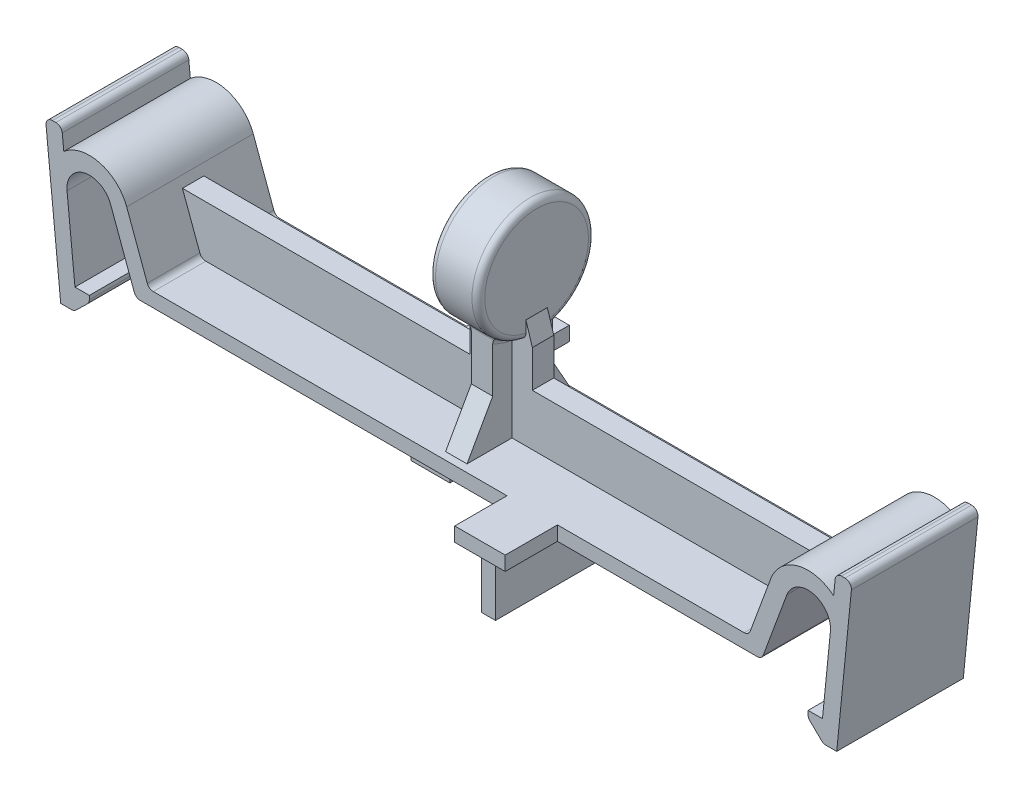
from build123d import *

# Parameters (mm, degrees)
BOSS_EXTRUDE1_DEPTH             = 7.385
BOSS_EXTRUDE2_REACH             = 51.333
BOSS_EXTRUDE2_DIRECTION_2_REACH = 51.333
BOSS_EXTRUDE3_DEPTH             = 1.25
BOSS_EXTRUDE4_DEPTH             = 2.5
SKETCH6_R                       = 6.8
BOSS_EXTRUDE5_DEPTH             = 2.875
FILLET1_R                       = 0.75
BOSS_EXTRUDE6_DEPTH             = 1.66
BOSS_EXTRUDE7_DEPTH             = 6.52
CUT_EXTRUDE1_DEPTH              = 56.58709885870133
CUT_EXTRUDE1_DEPTH_BACK         = 56.58709885870133
BOSS_EXTRUDE8_DEPTH             = 2.5


with BuildPart() as part:
    # Sketch2 → Boss-Extrude1 (new, symmetric)
    with BuildSketch(Plane.XY):
        with BuildLine():
            Line((-37.58052948652131, 8.667483902968542), (-35.18074791839629, 2.1508249005767097))
            ThreePointArc((-35.18074791839629, 2.1508249005767097), (-34.9059736753901, 1.794824689796692), (-34.47695230329278, 1.6599999999999993))
            Line((-34.47695230329278, 1.6599999999999993), (34.47695230329278, 1.6599999999999993))
            ThreePointArc((34.47695230329278, 1.6599999999999993), (34.9059736753901, 1.794824689796692), (35.18074791839629, 2.1508249005767097))
            Line((35.18074791839629, 2.1508249005767097), (37.58052948652131, 8.667483902968542))
            ThreePointArc((37.58052948652131, 8.667483902968542), (40.747280598577476, 11.545063491427863), (44.92008250779222, 10.598226060777561))
            Line((44.92008250779222, 10.598226060777561), (45.09820598941357, 12.38442253386073))
            ThreePointArc((45.09820598941357, 12.38442253386073), (45.341173921250764, 12.866020188660242), (45.84450437910348, 13.059999999999992))
            Line((45.84450437910348, 13.059999999999992), (46.246488363183424, 13.059999999999992))
            ThreePointArc((46.246488363183424, 13.059999999999992), (46.80250855184368, 12.813330457852704), (46.992786752873336, 12.235577466139242))
            Line((46.992786752873336, 12.235577466139242), (45.28, -4.940000000000007))
            Line((45.28, -4.940000000000007), (44.024420494730734, -4.940000000000006))
            ThreePointArc((44.024420494730734, -4.940000000000006), (43.7423500779441, -4.8849361697118825), (43.50169800131545, -4.727830079930183))
            Line((43.50169800131545, -4.727830079930183), (42.16727750658472, -3.4308933069615497))
            ThreePointArc((42.16727750658472, -3.4308933069615497), (41.999152017422986, -3.1850034006445043), (41.940000000000005, -2.89306322703137))
            Line((41.940000000000005, -2.89306322703137), (41.94, -2.4600000000000075))
            Line((41.94, -2.4600000000000075), (43.61788718673134, -2.460000000000006))
            Line((43.61788718673134, -2.460000000000006), (44.5419744029091, 6.806612752757441))
            ThreePointArc((44.5419744029091, 6.806612752757441), (42.51472618832063, 9.630449903014618), (39.457317793464, 7.976350304506424))
            Line((39.457317793464, 7.976350304506424), (36.700747918396296, 0.4908249005767054))
            ThreePointArc((36.700747918396296, 0.4908249005767054), (36.425973675390104, 0.1348246897966895), (35.99695230329279, -4.41e-15))
            Line((35.99695230329279, -4.41e-15), (-35.99695230329279, -4.41e-15))
            ThreePointArc((-35.99695230329279, -4.41e-15), (-36.425973675390104, 0.1348246897966895), (-36.700747918396296, 0.4908249005767054))
            Line((-36.700747918396296, 0.4908249005767054), (-39.457317793464, 7.976350304506424))
            ThreePointArc((-39.457317793464, 7.976350304506424), (-42.51472618832063, 9.63044990301462), (-44.5419744029091, 6.806612752757441))
            Line((-44.5419744029091, 6.806612752757441), (-43.61788718673134, -2.460000000000006))
            Line((-43.61788718673134, -2.460000000000006), (-41.94, -2.4600000000000075))
            Line((-41.94, -2.4600000000000075), (-41.940000000000005, -2.89306322703137))
            ThreePointArc((-41.940000000000005, -2.89306322703137), (-41.999152017422986, -3.1850034006445043), (-42.16727750658472, -3.4308933069615497))
            Line((-42.16727750658472, -3.4308933069615497), (-43.50169800131545, -4.727830079930183))
            ThreePointArc((-43.50169800131545, -4.727830079930183), (-43.7423500779441, -4.8849361697118825), (-44.024420494730734, -4.940000000000006))
            Line((-44.024420494730734, -4.940000000000006), (-45.28, -4.940000000000007))
            Line((-45.28, -4.940000000000007), (-46.992786752873336, 12.235577466139242))
            ThreePointArc((-46.992786752873336, 12.235577466139242), (-46.80250855184368, 12.813330457852704), (-46.246488363183424, 13.059999999999992))
            Line((-46.246488363183424, 13.059999999999992), (-45.84450437910348, 13.059999999999992))
            ThreePointArc((-45.84450437910348, 13.059999999999992), (-45.341173921250764, 12.866020188660242), (-45.09820598941357, 12.38442253386073))
            Line((-45.09820598941357, 12.38442253386073), (-44.92008250779222, 10.598226060777561))
            ThreePointArc((-44.92008250779222, 10.598226060777561), (-40.747280598577476, 11.545063491427863), (-37.58052948652131, 8.667483902968542))
        make_face()
    extrude(amount=BOSS_EXTRUDE1_DEPTH, both=True)

    # Sketch3 → Boss-Extrude2 (add, up to next)
    with BuildSketch(Plane(origin=(0, 0, 0), x_dir=(0, 0, -1), z_dir=(1, 0, 0)), mode=Mode.PRIVATE) as boss_extrude2_sk1:
        Polygon((-1.250000000000001, 1.6599999999999993), (1.250000000000001, 1.6599999999999993), (1.249999999999999, 7.659999999999999), (-1.250000000000001, 7.659999999999999), align=None)
    boss_extrude2_tool1 = extrude(boss_extrude2_sk1.sketch, amount=BOSS_EXTRUDE2_REACH, mode=Mode.PRIVATE) - part.part
    add(boss_extrude2_tool1.solids().sort_by_distance((0, 4.66, 0))[0])

    # Sketch3 → Boss-Extrude2 direction 2 (add, up to next)
    with BuildSketch(Plane(origin=(0, 0, 0), x_dir=(0, 0, -1), z_dir=(1, 0, 0)), mode=Mode.PRIVATE) as boss_extrude2_direction_2_sk1:
        Polygon((-1.250000000000001, 1.6599999999999993), (1.250000000000001, 1.6599999999999993), (1.249999999999999, 7.659999999999999), (-1.250000000000001, 7.659999999999999), align=None)
    boss_extrude2_direction_2_tool1 = extrude(boss_extrude2_direction_2_sk1.sketch, amount=-BOSS_EXTRUDE2_DIRECTION_2_REACH, mode=Mode.PRIVATE) - part.part
    add(boss_extrude2_direction_2_tool1.solids().sort_by_distance((0, 4.66, 0))[0])

    # Sketch4 → Boss-Extrude3 (add, symmetric)
    with BuildSketch(Plane(origin=(0, 0, 0), x_dir=(0, 0, -1), z_dir=(1, 0, 0))):
        Polygon((-6.5, 1.6599999999999993), (-3.4999999999999996, 6.999999999999997), (-3.5, 15.66), (3.5, 15.66), (3.4999999999999996, 6.999999999999997), (6.5, 1.6599999999999993), align=None)
    extrude(amount=BOSS_EXTRUDE3_DEPTH, both=True)

    # Sketch5 → Boss-Extrude4 (add)
    with BuildSketch(Plane.XY.offset(1.250000000000001)):
        Polygon((-3.625000000000003, 7.659999999999998), (3.625000000000005, 7.659999999999999), (3.6249999999999973, 11.979999999999999), (-3.625000000000003, 11.979999999999997), align=None)
    extrude(amount=-BOSS_EXTRUDE4_DEPTH)

    # Sketch6 → Boss-Extrude5 (add, symmetric)
    with BuildSketch(Plane(origin=(0, 0, 0), x_dir=(0, 0, -1), z_dir=(1, 0, 0))):
        with Locations((0, 18.970824900576712)):
            Circle(SKETCH6_R)
    extrude(amount=BOSS_EXTRUDE5_DEPTH, both=True)

    # Fillet1
    # the kernel refuses this fillet: 0.75 mm, written as the material it adds along each edge
    with BuildSketch(Plane(origin=(-1.25, 18.970824900576712, 0), x_dir=(0, -0.6848107633394334, 0.7287209468750454), z_dir=(0, 0.7287209468750454, 0.6848107633394334))) as fillet1_piece_1_section:
        with BuildLine():
            CenterArc((6.800000000000002 + FILLET1_R, -FILLET1_R), FILLET1_R, 90, 90)
            Line((6.800000000000002, -FILLET1_R), (6.800000000000002, 0))
            Line((6.800000000000002, 0), (6.800000000000002 + FILLET1_R, 0))
        make_face()
    fillet1_piece_1 = revolve(axis=Axis((-1.25, 18.970824900576712, 0), (1, 0, 0)), revolution_arc=93.55854684845208, mode=Mode.PRIVATE)
    fillet1_piece_1 = split(fillet1_piece_1, bisect_by=Plane(origin=(-1.462478270743082, 11.958346629833628, -3.5), z_dir=(0, 5e-17, 1)), keep=Keep.TOP, mode=Mode.PRIVATE)
    fillet1_piece_1 = split(fillet1_piece_1, bisect_by=Plane(origin=(-1.462478270743082, 11.958346629833628, 3.5), z_dir=(0, 5e-17, -1)), keep=Keep.TOP, mode=Mode.PRIVATE)
    add(fillet1_piece_1)
    with BuildSketch(Plane(origin=(-1.25, 13.140730561717348, -3.4999999999999996), x_dir=(0, -1, -1.08e-15), z_dir=(1, 0, 0))) as fillet1_piece_2:
        with BuildLine():
            CenterArc((0.41009796586971076, 0.75), FILLET1_R, 214.2575543531148, 55.74244564688513)
            ThreePointArc((-0.2097886869179458, 0.32781456953642274), (-0.10254856555185103, 0.16540849219664022), (0, 0))
            Line((0, 0), (0.4100979658697099, 0))
        make_face()
    extrude(amount=2.5)
    with BuildSketch(Plane(origin=(1.25, 18.970824900576712, 0), x_dir=(0, -0.6848107633394334, 0.7287209468750454), z_dir=(0, 0.7287209468750454, 0.6848107633394334))) as fillet1_piece_3_section:
        with BuildLine():
            CenterArc((6.800000000000002 + FILLET1_R, FILLET1_R), FILLET1_R, 180, 90)
            Line((6.800000000000002, FILLET1_R), (6.800000000000002, 0))
            Line((6.800000000000002, 0), (6.800000000000002 + FILLET1_R, 0))
        make_face()
    fillet1_piece_3 = revolve(axis=Axis((1.25, 18.970824900576712, 0), (1, 0, 0)), revolution_arc=93.55854684845208, mode=Mode.PRIVATE)
    fillet1_piece_3 = split(fillet1_piece_3, bisect_by=Plane(origin=(1.462478270743082, 11.958346629833628, -3.5), z_dir=(0, 5e-17, 1)), keep=Keep.TOP, mode=Mode.PRIVATE)
    fillet1_piece_3 = split(fillet1_piece_3, bisect_by=Plane(origin=(1.462478270743082, 11.958346629833628, 3.5), z_dir=(0, 5e-17, -1)), keep=Keep.TOP, mode=Mode.PRIVATE)
    add(fillet1_piece_3)
    with BuildSketch(Plane(origin=(-1.25, 13.140730561717348, 3.4999999999999996), x_dir=(0, 0.5390306606171568, 0.8422861431334554), z_dir=(1, 0, 0))) as fillet1_piece_4:
        with BuildLine():
            CenterArc((0.41065922988959225, 0.7496928294421427), FILLET1_R, 212.61767606687343, 55.74244564688547)
            Line((-0.22105537746050125, 0.34541983397927806), (0, 0))
            ThreePointArc((0, 0), (0.1945981019685865, 0.00278501305790487), (0.389196203937177, 0))
        make_face()
    extrude(amount=2.5)
    with BuildSketch(Plane(origin=(-1.25, 18.970824900576712, 0), x_dir=(0, -0.6848107633394334, 0.7287209468750454), z_dir=(0, 0.7287209468750454, 0.6848107633394334))) as fillet1_piece_5a_section:
        with BuildLine():
            CenterArc((6.800000000000002 + FILLET1_R, -FILLET1_R), FILLET1_R, 90, 90)
            Line((6.800000000000002, -FILLET1_R), (6.800000000000002, 0))
            Line((6.800000000000002, 0), (6.800000000000002 + FILLET1_R, 0))
        make_face()
    fillet1_piece_5a = revolve(axis=Axis((-1.25, 18.970824900576712, 0), (1, 0, 0)), revolution_arc=93.55854684845208, mode=Mode.PRIVATE)
    fillet1_piece_5a = split(fillet1_piece_5a, bisect_by=Plane(origin=(-1.4131565806367208, 13.522065937432895, 3.5), z_dir=(0, -5e-17, 1)), keep=Keep.TOP, mode=Mode.PRIVATE)
    with BuildSketch(Plane(origin=(-2.2752449146742837, 13.14073056171735, 3.5000000000000018), x_dir=(0, 0.5390306606171561, 0.8422861431334557), z_dir=(1, 0, 0))) as fillet1_piece_5b_section:
        with BuildLine():
            CenterArc((0.4106592298895899, 0.7496928294421427), FILLET1_R, 212.6176760668734, 55.74244564688547)
            Line((-0.2210553774605038, 0.3454198339792785), (0, 0))
            ThreePointArc((0, 0), (0.19459810196858365, 0.00278501305790504), (0.38919620393717413, 0))
        make_face()
    fillet1_piece_5b = extrude(amount=3.5252449146742837, mode=Mode.PRIVATE)
    fillet1_piece_5b = split(fillet1_piece_5b, bisect_by=Plane(origin=(-1.25, 13.094356378166701, 3.570647567058961), z_dir=(-1, 0, 0)), keep=Keep.TOP, mode=Mode.PRIVATE)
    fillet1_piece_5 = fillet1_piece_5a & fillet1_piece_5b
    add(fillet1_piece_5)
    with BuildSketch(Plane(origin=(-1.25, 18.970824900576712, 0), x_dir=(0, -0.6848107633394334, 0.7287209468750454), z_dir=(0, 0.7287209468750454, 0.6848107633394334))) as fillet1_piece_6a_section:
        with BuildLine():
            CenterArc((6.800000000000002 + FILLET1_R, -FILLET1_R), FILLET1_R, 90, 90)
            Line((6.800000000000002, -FILLET1_R), (6.800000000000002, 0))
            Line((6.800000000000002, 0), (6.800000000000002 + FILLET1_R, 0))
        make_face()
    fillet1_piece_6a = revolve(axis=Axis((-1.25, 18.970824900576712, 0), (1, 0, 0)), revolution_arc=93.55854684845208, mode=Mode.PRIVATE)
    fillet1_piece_6a = split(fillet1_piece_6a, bisect_by=Plane(origin=(-1.413156631230589, 13.522066011811498, -3.5), z_dir=(0, -5e-17, -1)), keep=Keep.TOP, mode=Mode.PRIVATE)
    with BuildSketch(Plane(origin=(-2.275244914674275, 13.140730561717348, -3.5), x_dir=(0, -1, 0), z_dir=(1, 0, 0))) as fillet1_piece_6b_section:
        with BuildLine():
            CenterArc((0.4100979658697099, 0.75), FILLET1_R, 214.25755435311487, 55.74244564688513)
            ThreePointArc((-0.20978868691794617, 0.3278145695364221), (-0.10254856555185121, 0.16540849219663967), (0, 0))
            Line((0, 0), (0.4100979658697099, 0))
        make_face()
    fillet1_piece_6b = extrude(amount=3.525244914674275, mode=Mode.PRIVATE)
    fillet1_piece_6b = split(fillet1_piece_6b, bisect_by=Plane(origin=(-1.25, 13.094356378166696, -3.570647567058956), z_dir=(-1, 0, 0)), keep=Keep.TOP, mode=Mode.PRIVATE)
    fillet1_piece_6 = fillet1_piece_6a & fillet1_piece_6b
    add(fillet1_piece_6)
    with BuildSketch(Plane(origin=(1.25, 18.970824900576712, 0), x_dir=(0, -0.6848107633394334, 0.7287209468750454), z_dir=(0, 0.7287209468750454, 0.6848107633394334))) as fillet1_piece_7a_section:
        with BuildLine():
            CenterArc((6.800000000000002 + FILLET1_R, FILLET1_R), FILLET1_R, 180, 90)
            Line((6.800000000000002, FILLET1_R), (6.800000000000002, 0))
            Line((6.800000000000002, 0), (6.800000000000002 + FILLET1_R, 0))
        make_face()
    fillet1_piece_7a = revolve(axis=Axis((1.25, 18.970824900576712, 0), (1, 0, 0)), revolution_arc=93.55854684845208, mode=Mode.PRIVATE)
    fillet1_piece_7a = split(fillet1_piece_7a, bisect_by=Plane(origin=(1.413156631230589, 13.522066011811496, -3.5), z_dir=(0, -5e-17, -1)), keep=Keep.TOP, mode=Mode.PRIVATE)
    with BuildSketch(Plane(origin=(-1.25, 13.140730561717348, -3.4999999999999996), x_dir=(0, -1, -1.08e-15), z_dir=(1, 0, 0))) as fillet1_piece_7b_section:
        with BuildLine():
            CenterArc((0.41009796586971076, 0.75), FILLET1_R, 214.2575543531148, 55.74244564688513)
            ThreePointArc((-0.2097886869179458, 0.32781456953642274), (-0.10254856555185103, 0.16540849219664022), (0, 0))
            Line((0, 0), (0.4100979658697099, 0))
        make_face()
    fillet1_piece_7b = extrude(amount=3.525244914674275, mode=Mode.PRIVATE)
    fillet1_piece_7b = split(fillet1_piece_7b, bisect_by=Plane(origin=(1.25, 13.094356378166696, -3.570647567058956), z_dir=(1, 0, 0)), keep=Keep.TOP, mode=Mode.PRIVATE)
    fillet1_piece_7 = fillet1_piece_7a & fillet1_piece_7b
    add(fillet1_piece_7)
    with BuildSketch(Plane(origin=(1.25, 18.970824900576712, 0), x_dir=(0, -0.6848107633394334, 0.7287209468750454), z_dir=(0, 0.7287209468750454, 0.6848107633394334))) as fillet1_piece_8a_section:
        with BuildLine():
            CenterArc((6.800000000000002 + FILLET1_R, FILLET1_R), FILLET1_R, 180, 90)
            Line((6.800000000000002, FILLET1_R), (6.800000000000002, 0))
            Line((6.800000000000002, 0), (6.800000000000002 + FILLET1_R, 0))
        make_face()
    fillet1_piece_8a = revolve(axis=Axis((1.25, 18.970824900576712, 0), (1, 0, 0)), revolution_arc=93.55854684845208, mode=Mode.PRIVATE)
    fillet1_piece_8a = split(fillet1_piece_8a, bisect_by=Plane(origin=(1.4131565806367206, 13.522065937432895, 3.5), z_dir=(0, -5e-17, 1)), keep=Keep.TOP, mode=Mode.PRIVATE)
    with BuildSketch(Plane(origin=(-1.25, 13.140730561717348, 3.4999999999999996), x_dir=(0, 0.5390306606171568, 0.8422861431334554), z_dir=(1, 0, 0))) as fillet1_piece_8b_section:
        with BuildLine():
            CenterArc((0.41065922988959225, 0.7496928294421427), FILLET1_R, 212.61767606687343, 55.74244564688547)
            Line((-0.22105537746050125, 0.34541983397927806), (0, 0))
            ThreePointArc((0, 0), (0.1945981019685865, 0.00278501305790487), (0.389196203937177, 0))
        make_face()
    fillet1_piece_8b = extrude(amount=3.5252449146742837, mode=Mode.PRIVATE)
    fillet1_piece_8b = split(fillet1_piece_8b, bisect_by=Plane(origin=(1.25, 13.094356378166703, 3.5706475670589612), z_dir=(1, 0, 0)), keep=Keep.TOP, mode=Mode.PRIVATE)
    fillet1_piece_8 = fillet1_piece_8a & fillet1_piece_8b
    add(fillet1_piece_8)
    # the kernel refuses this fillet: 0.75 mm, written as the material it takes off along each edge
    with BuildSketch(Plane(origin=(-2.875, 18.970824900576712, 0), x_dir=(0, 0, -1), z_dir=(0, -1, 0))) as fillet1_2_piece_1:
        with BuildLine():
            CenterArc((6.8 - FILLET1_R, FILLET1_R), FILLET1_R, 270, 90)
            Line((6.8 - FILLET1_R, 0), (6.8, 0))
            Line((6.8, 0), (6.8, FILLET1_R))
        make_face()
    revolve(axis=Axis((-2.875, 18.970824900576712, 0), (1, 0, 0)), mode=Mode.SUBTRACT)
    with BuildSketch(Plane(origin=(2.875, 18.970824900576712, 0), x_dir=(0, 0, -1), z_dir=(0, -1, 0))) as fillet1_2_piece_2:
        with BuildLine():
            CenterArc((6.8 - FILLET1_R, -FILLET1_R), FILLET1_R, 0, 90)
            Line((6.8 - FILLET1_R, 0), (6.8, 0))
            Line((6.8, 0), (6.8, -FILLET1_R))
        make_face()
    revolve(axis=Axis((2.875, 18.970824900576712, 0), (1, 0, 0)), mode=Mode.SUBTRACT)

    # Sketch7 → Boss-Extrude6 (add)
    with BuildSketch(Plane(origin=(0, 1.6599999999999993, 0), x_dir=(1, 0, 0), z_dir=(0, 1, 0))):
        Polygon((-12.689999999999998, 7.385000000000002), (-6.8000000000000025, 7.384999999999998), (-6.8000000000000025, 13.485000000000003), (-12.690000000000001, 13.485000000000003), align=None)
        Polygon((6.800000000000004, -7.384999999999996), (12.69, -7.384999999999998), (12.690000000000005, -13.485), (6.800000000000006, -13.485000000000003), align=None)
    extrude(amount=-BOSS_EXTRUDE6_DEPTH)

    # Sketch8 → Boss-Extrude7 (add)
    with BuildSketch(Plane.XZ):
        Polygon((10.555000000000007, 12.485000000000003), (10.555000000000007, -1.250000000000001), (-8.935000000000004, -1.2500000000000036), (-8.935000000000002, -12.485000000000003), (-10.555000000000001, -12.485000000000003), (-10.555000000000001, 1.250000000000001), (8.935000000000004, 1.250000000000001), (8.935000000000008, 12.485000000000003), align=None)
    extrude(amount=BOSS_EXTRUDE7_DEPTH)

    # Sketch9 → Cut-Extrude1 (cut, two sides: drawn at the far end of the back side and taken through both)
    with BuildSketch(Plane.XY.offset(1.250000000000001).offset(-CUT_EXTRUDE1_DEPTH_BACK)):
        Polygon((6.000000000000001, -6.52), (-5.999999999999999, -6.520000000000001), (-6.000000000000001, -2.520000000000001), (6.000000000000001, -2.5199999999999996), align=None)
    extrude(amount=CUT_EXTRUDE1_DEPTH + CUT_EXTRUDE1_DEPTH_BACK, mode=Mode.SUBTRACT)

    # Sketch11 → Boss-Extrude8 (add)
    with BuildSketch(Plane.XY.offset(1.250000000000001)):
        Polygon((-3.625000000000003, 11.979999999999997), (-2.875, 14.402209312499231), (2.875, 14.402209312499231), (3.6249999999999973, 11.979999999999999), align=None)
    extrude(amount=-BOSS_EXTRUDE8_DEPTH)


solid = part.part
